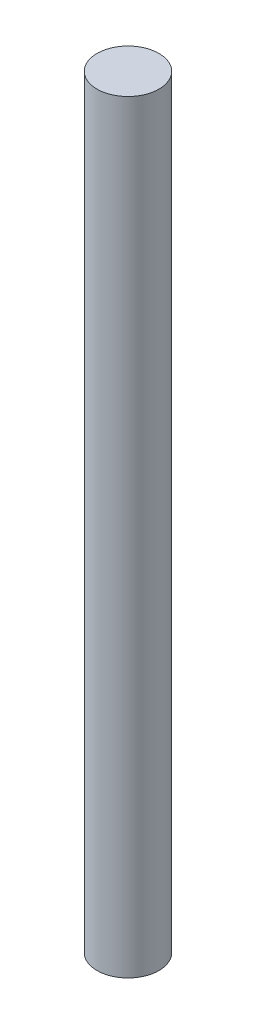
from build123d import *

# Parameters (mm, degrees)
SKETCH1_R           = 1.5
BOSS_EXTRUDE1_DEPTH = 37


with BuildPart() as part:
    # Sketch1 → Boss-Extrude1 (new body)
    with BuildSketch(Plane(origin=(0, 0, 0), x_dir=(1, 0, 0), z_dir=(0, 1, 0))):
        Circle(SKETCH1_R)
    extrude(amount=BOSS_EXTRUDE1_DEPTH)


solid = part.part
